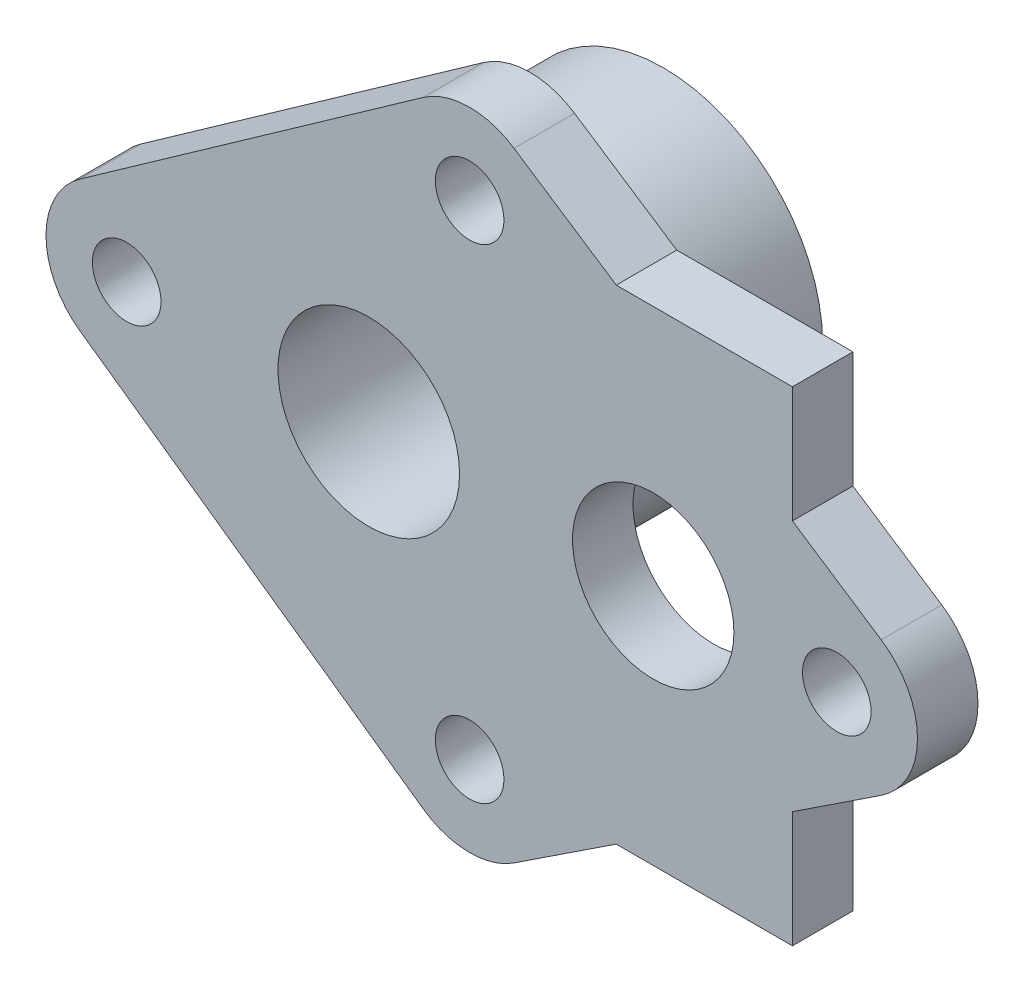
from build123d import *

# Parameters (mm, degrees)
SZKIC1_R                    = 7.9
SZKIC1_R_2                  = 4.75
DODANIE_WYCI_GNI_CIE1_DEPTH = 11.6
DODANIE_WYCI_GNI_CIE2_START = -0.5
SZKIC2_R                    = 4.75
SZKIC2_R_2                  = 4.5
DODANIE_WYCI_GNI_CIE2_DEPTH = 0.5
SFAZOWANIE1_SIZE            = 11.5
SFAZOWANIE1_SIZE_2          = 0.5
SZKIC4_R                    = 4
SZKIC4_R_2                  = 1.7
SZKIC4_R_3                  = 4.5
DODANIE_WYCI_GNI_CIE4_DEPTH = 3
DODANIE_WYCI_GNI_CIE5_DEPTH = 3


with BuildPart() as part:
    # Szkic1 → Dodanie-wyciągnięcie1 (new body)
    with BuildSketch(Plane.XY):
        Circle(SZKIC1_R)
        Circle(SZKIC1_R_2, mode=Mode.SUBTRACT)
    extrude(amount=DODANIE_WYCI_GNI_CIE1_DEPTH)

    # Szkic2 → Dodanie-wyciągnięcie2 (add)
    with BuildSketch(Plane.XY.offset(11.6).offset(DODANIE_WYCI_GNI_CIE2_START)):
        Circle(SZKIC2_R)
        Circle(SZKIC2_R_2, mode=Mode.SUBTRACT)
    extrude(amount=DODANIE_WYCI_GNI_CIE2_DEPTH)

    # Sfazowanie1
    # the kernel refuses this chamfer: 11.5, 0.5 mm, written as the material it adds along each edge
    with BuildSketch(Plane(origin=(0, 0, 11.1), x_dir=(1, 0, 0), z_dir=(0, -1, 0))) as sfazowanie1_piece_1_section:
        Polygon((4.75, -SFAZOWANIE1_SIZE), (4.75 - SFAZOWANIE1_SIZE_2, 0), (4.75, 0), align=None)
    sfazowanie1_piece_1 = revolve(axis=Axis((0, 0, 11.1), (0, 0, 1)), mode=Mode.PRIVATE)
    sfazowanie1_piece_1 = split(sfazowanie1_piece_1, bisect_by=Plane(origin=(-4.668659179, 0, 0), z_dir=(0, 0, 1)), keep=Keep.TOP, mode=Mode.PRIVATE)
    sfazowanie1_piece_1 = sfazowanie1_piece_1 - Plane(origin=(0, 0, 2.677276297), x_dir=(1, 0, 0), z_dir=(0, 0, -1)) * Cylinder(4.5, 46, mode=Mode.PRIVATE)
    add(sfazowanie1_piece_1)

    # Szkic4 → Dodanie-wyciągnięcie4 (add)
    with BuildSketch(Plane.XY.offset(11.6)):
        with BuildLine():
            Line((2.69326721, 15.267871453), (-14.30673279, 3.267871453))
            ThreePointArc((-14.30673279, 3.267871453), (-16, 0), (-14.30673279, -3.267871453))
            Line((-14.30673279, -3.267871453), (2.69326721, -15.267871453))
            ThreePointArc((2.69326721, -15.267871453), (4.936503941, -15.999496), (7.201834862, -15.339449541))
            Line((7.201834862, -15.339449541), (25.401834862, -3.339449541))
            ThreePointArc((25.401834862, -3.339449541), (27.2, 0), (25.401834862, 3.339449541))
            Line((25.401834862, 3.339449541), (7.201834862, 15.339449541))
            ThreePointArc((7.201834862, 15.339449541), (4.936503941, 15.999496), (2.69326721, 15.267871453))
        make_face()
        with Locations((14.1, 0)):
            Circle(SZKIC4_R, mode=Mode.SUBTRACT)
        with Locations((-12, 0)):
            Circle(SZKIC4_R_2, mode=Mode.SUBTRACT)
        with Locations((5, 12)):
            Circle(SZKIC4_R_2, mode=Mode.SUBTRACT)
        with Locations((5, -12)):
            Circle(SZKIC4_R_2, mode=Mode.SUBTRACT)
        with Locations((23.2, 0)):
            Circle(SZKIC4_R_2, mode=Mode.SUBTRACT)
        Circle(SZKIC4_R_3, mode=Mode.SUBTRACT)
    extrude(amount=DODANIE_WYCI_GNI_CIE4_DEPTH)

    # Szkic5 → Dodanie-wyciągnięcie5 (add)
    with BuildSketch(Plane.XY.offset(14.6)):
        Polygon((21, -12), (21, -6.241758242), (12.266666667, -12), align=None)
        Polygon((21, 12), (12.266666667, 12), (21, 6.241758242), align=None)
    extrude(amount=-DODANIE_WYCI_GNI_CIE5_DEPTH)


solid = part.part
